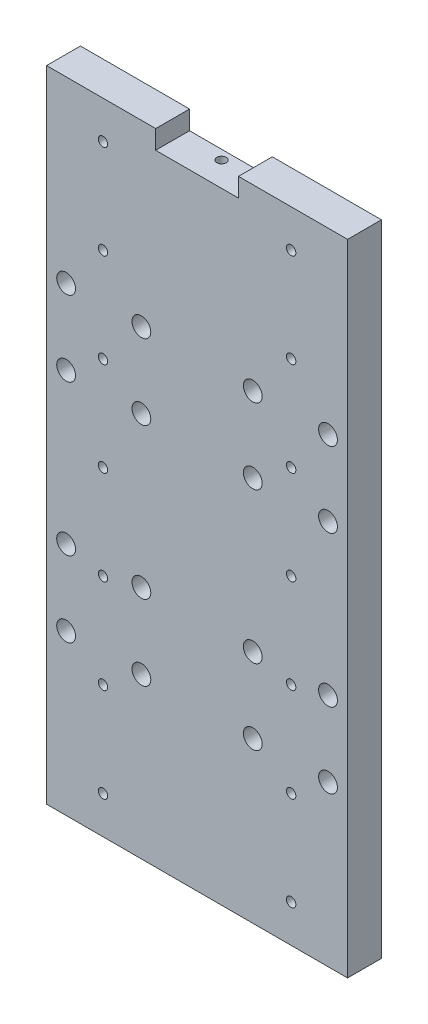
from build123d import *

# Parameters (mm, degrees)
ESQUISSE1_W             = 80
ESQUISSE1_H             = 170
BOSS_EXTRU_1_DEPTH      = 9
ESQUISSE2_R             = 1.25
ENL_V_MAT_EXTRU_1_DEPTH = 189.098378515
ESQUISSE4_W             = 22
ESQUISSE4_H             = 5
ENL_V_MAT_EXTRU_3_DEPTH = 189.098378515
ESQUISSE5_R             = 1.25
ENL_V_MAT_EXTRU_4_DEPTH = 10
ESQUISSE6_R             = 2.5
ENL_V_MAT_EXTRU_5_DEPTH = 189.098378515


with BuildPart() as part:
    # Esquisse1 → Boss.-Extru.1 (new body)
    with BuildSketch(Plane.XY):
        with Locations((40, 85)):
            Rectangle(ESQUISSE1_W, ESQUISSE1_H)
    extrude(amount=BOSS_EXTRU_1_DEPTH)

    # Esquisse2 → Enlèv. mat.-Extru.1 (cut, through all)
    with BuildSketch(Plane.XY.offset(9)):
        with Locations((15, 10)):
            Circle(ESQUISSE2_R)
        with Locations((65, 10)):
            Circle(ESQUISSE2_R)
        with Locations((15, 35)):
            Circle(ESQUISSE2_R)
        with Locations((65, 35)):
            Circle(ESQUISSE2_R)
        with Locations((15, 60)):
            Circle(ESQUISSE2_R)
        with Locations((65, 60)):
            Circle(ESQUISSE2_R)
        with Locations((15, 85)):
            Circle(ESQUISSE2_R)
        with Locations((65, 85)):
            Circle(ESQUISSE2_R)
        with Locations((15, 110)):
            Circle(ESQUISSE2_R)
        with Locations((65, 110)):
            Circle(ESQUISSE2_R)
        with Locations((15, 135)):
            Circle(ESQUISSE2_R)
        with Locations((65, 135)):
            Circle(ESQUISSE2_R)
        with Locations((15, 160)):
            Circle(ESQUISSE2_R)
        with Locations((65, 160)):
            Circle(ESQUISSE2_R)
        with Locations((15, 185)):
            Circle(ESQUISSE2_R)
        with Locations((65, 185)):
            Circle(ESQUISSE2_R)
    extrude(amount=-ENL_V_MAT_EXTRU_1_DEPTH, mode=Mode.SUBTRACT)

    # Esquisse4 → Enlèv. mat.-Extru.3 (cut, through all)
    with BuildSketch(Plane.XY.offset(9)):
        with Locations((40, 167.5)):
            Rectangle(ESQUISSE4_W, ESQUISSE4_H)
    extrude(amount=-ENL_V_MAT_EXTRU_3_DEPTH, mode=Mode.SUBTRACT)

    # Esquisse5 → Enlèv. mat.-Extru.4 (cut)
    with BuildSketch(Plane(origin=(0, 165, 0), x_dir=(1, 0, 0), z_dir=(0, 1, 0))):
        with Locations((40, -2.5)):
            Circle(ESQUISSE5_R)
    extrude(amount=-ENL_V_MAT_EXTRU_4_DEPTH, mode=Mode.SUBTRACT)

    # Esquisse6 → Enlèv. mat.-Extru.5 (cut, through all)
    with BuildSketch(Plane.XY.offset(9)):
        with Locations((74.8, 122.5)):
            Circle(ESQUISSE6_R)
        with Locations((74.8, 62.5)):
            Circle(ESQUISSE6_R)
        with Locations((74.8, 102.5)):
            Circle(ESQUISSE6_R)
        with Locations((74.8, 42.5)):
            Circle(ESQUISSE6_R)
        with Locations((5.2, 42.5)):
            Circle(ESQUISSE6_R)
        with Locations((5.2, 102.5)):
            Circle(ESQUISSE6_R)
        with Locations((5.2, 62.5)):
            Circle(ESQUISSE6_R)
        with Locations((5.2, 122.5)):
            Circle(ESQUISSE6_R)
        with Locations((54.8, 102.5)):
            Circle(ESQUISSE6_R)
        with Locations((54.8, 122.5)):
            Circle(ESQUISSE6_R)
        with Locations((54.8, 42.5)):
            Circle(ESQUISSE6_R)
        with Locations((54.8, 62.5)):
            Circle(ESQUISSE6_R)
        with Locations((25.2, 62.5)):
            Circle(ESQUISSE6_R)
        with Locations((25.2, 42.5)):
            Circle(ESQUISSE6_R)
        with Locations((25.2, 122.5)):
            Circle(ESQUISSE6_R)
        with Locations((25.2, 102.5)):
            Circle(ESQUISSE6_R)
    extrude(amount=-ENL_V_MAT_EXTRU_5_DEPTH, mode=Mode.SUBTRACT)


solid = part.part
